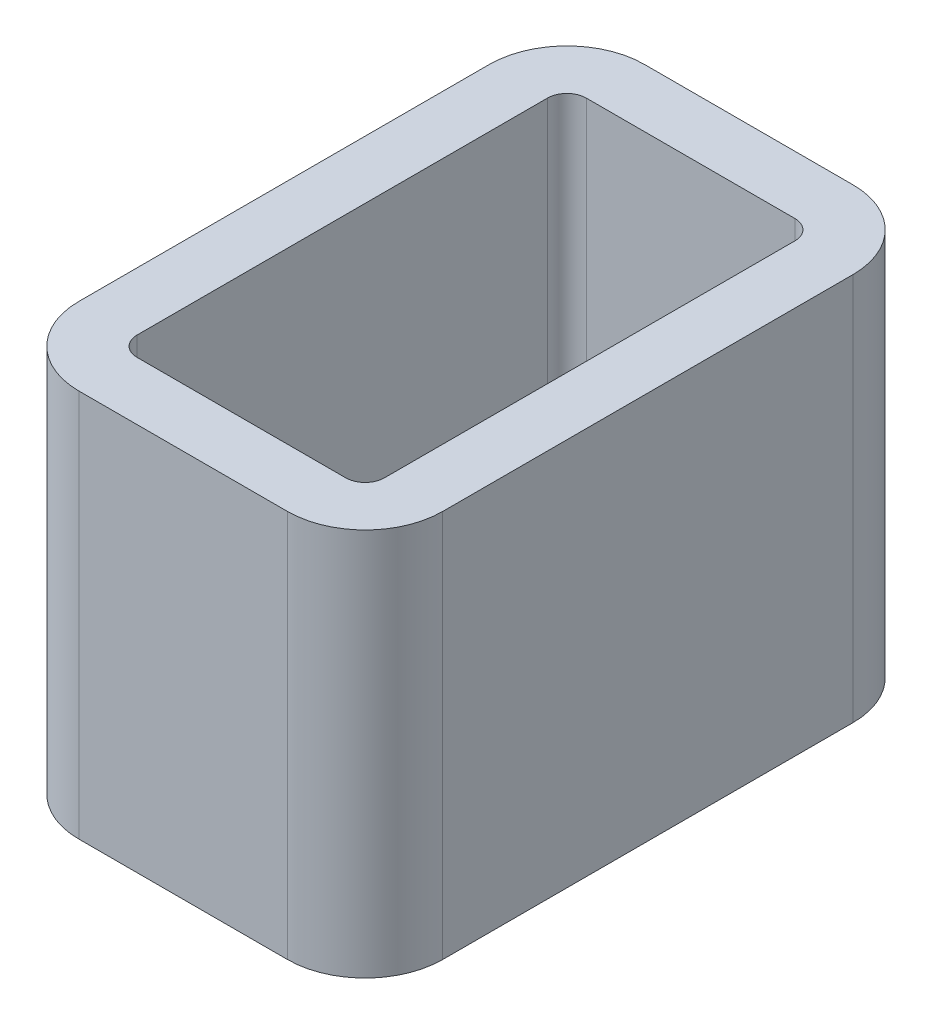
from build123d import *

# Parameters (mm, degrees)
BOSS_EXTRUDE1_DEPTH = 20


with BuildPart() as part:
    # Sketch1 → Boss-Extrude1 (new body)
    with BuildSketch(Plane(origin=(0, 0, 0), x_dir=(1, 0, 0), z_dir=(0, 1, 0))):
        with BuildLine():
            Line((-5.375, 14.575), (5.375, 14.575))
            ThreePointArc((5.375, 14.575), (8.203427125, 13.403427125), (9.375, 10.575))
            Line((9.375, 10.575), (9.375, -10.575))
            ThreePointArc((9.375, -10.575), (8.203427125, -13.403427125), (5.375, -14.575))
            Line((5.375, -14.575), (-5.375, -14.575))
            ThreePointArc((-5.375, -14.575), (-8.203427125, -13.403427125), (-9.375, -10.575))
            Line((-9.375, -10.575), (-9.375, 10.575))
            ThreePointArc((-9.375, 10.575), (-8.203427125, 13.403427125), (-5.375, 14.575))
        make_face()
        with BuildLine():
            Line((-5.375, 11.575), (5.375, 11.575))
            ThreePointArc((5.375, 11.575), (6.082106781, 11.282106781), (6.375, 10.575))
            Line((6.375, 10.575), (6.375, -10.575))
            ThreePointArc((6.375, -10.575), (6.082106781, -11.282106781), (5.375, -11.575))
            Line((5.375, -11.575), (-5.375, -11.575))
            ThreePointArc((-5.375, -11.575), (-6.082106781, -11.282106781), (-6.375, -10.575))
            Line((-6.375, -10.575), (-6.375, 10.575))
            ThreePointArc((-6.375, 10.575), (-6.082106781, 11.282106781), (-5.375, 11.575))
        make_face(mode=Mode.SUBTRACT)
    extrude(amount=BOSS_EXTRUDE1_DEPTH)


solid = part.part
